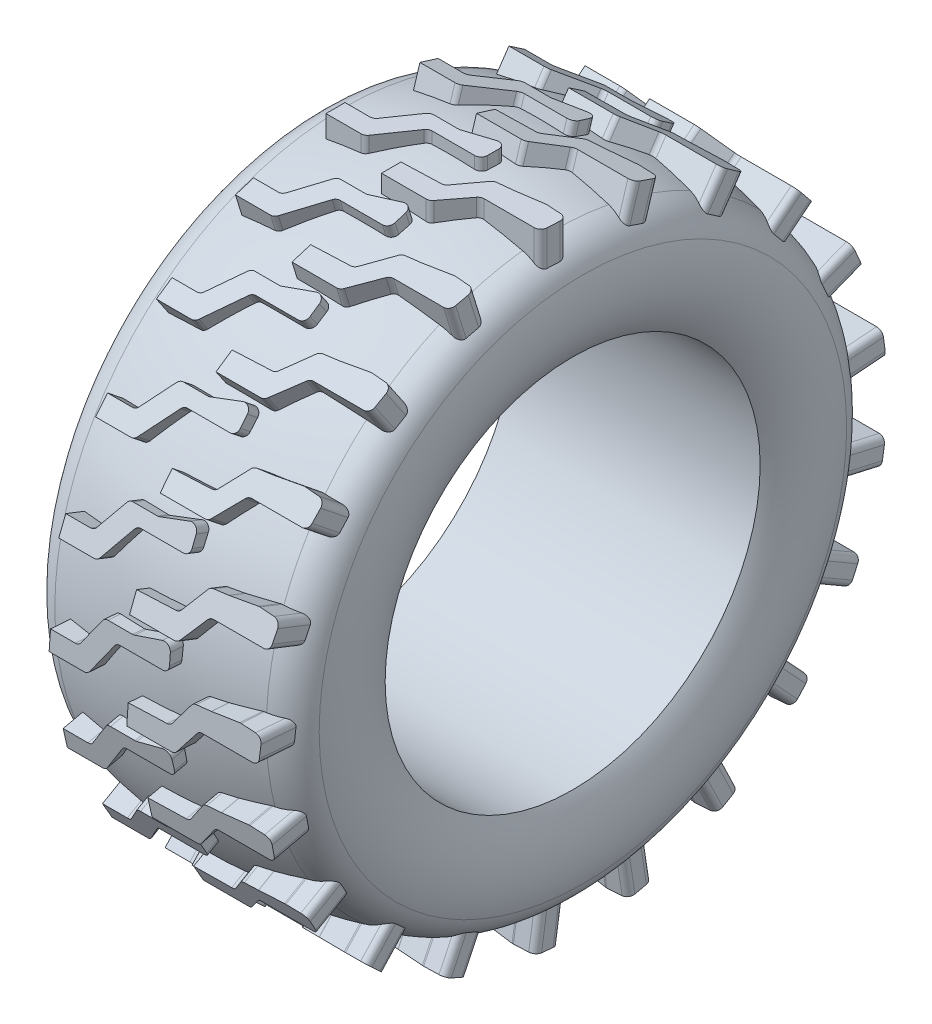
from build123d import *

# Parameters (mm, degrees)
FILLET1_R           = 60
BOSS_EXTRUDE1_DEPTH = 74
CIRPATTERN1_COUNT   = 21


with BuildPart() as part:
    # Sketch2 → Revolve1 (revolve)
    with BuildSketch(Plane.XY):
        with BuildLine():
            Line((190.247405012, 290), (-189.752594988, 290))
            ThreePointArc((-189.752594988, 290), (-213.203625034, 364.848351988), (-190.743518031, 440))
            ThreePointArc((-190.743518031, 440), (-0.248050176, 466.418915997), (190.247417679, 440))
            ThreePointArc((190.247417679, 440), (213.202375437, 364.999998061), (190.247405012, 290))
        make_face()
    revolve(axis=Axis((-383.89527027, 0, 0), (1, 0, 0)))

    # Fillet1
    fillet1_edges = [part.edges().sort_by_distance(p)[0] for p in [
        (-190.743518031, -440, 0),
        (190.247417679, -440, 0),
    ]]
    fillet(fillet1_edges, radius=FILLET1_R)

    # Sketch3 → Boss-Extrude1 (add)
    with BuildSketch(Plane(origin=(0, 410, 0), x_dir=(1, 0, 0), z_dir=(0, 1, 0))):
        with BuildLine():
            Line((48.626858711, 27.351216398), (48.626858711, 10))
            ThreePointArc((48.626858711, 10), (45.697926523, 2.928932188), (38.626858711, 0))
            Line((38.626858711, 0), (-26.948197392, 0))
            ThreePointArc((-26.948197392, 0), (-31.585344317, -1.140154155), (-35.165078775, -4.300626321))
            Line((-35.165078775, -4.300626321), (-69.999694364, -54.522268286))
            ThreePointArc((-69.999694364, -54.522268286), (-73.579428823, -57.682740452), (-78.216575748, -58.822894607))
            Line((-78.216575748, -58.822894607), (-132.401028151, -58.822894607))
            Line((-132.401028151, -58.822894607), (-132.401028151, -29.411447303))
            Line((-132.401028151, -29.411447303), (-94.061467377, -29.411447303))
            ThreePointArc((-94.061467377, -29.411447303), (-89.424320452, -28.271293148), (-85.844585994, -25.110820982))
            Line((-85.844585994, -25.110820982), (-55.565376747, 18.543216245))
            ThreePointArc((-55.565376747, 18.543216245), (-51.985642289, 21.703688411), (-47.348495364, 22.843842566))
            Line((-47.348495364, 22.843842566), (-9.546597048, 22.843842566))
            ThreePointArc((-9.546597048, 22.843842566), (-7.994583592, 22.96501398), (-6.480182069, 23.325591719))
            Line((-6.480182069, 23.325591719), (35.560443732, 36.869467244))
            ThreePointArc((35.560443732, 36.869467244), (44.514806155, 35.43404232), (48.626858711, 27.351216398))
        make_face()
        with BuildLine():
            Line((-9.546597048, -65.670623662), (-9.546597048, -95.795524072))
            Line((-9.546597048, -95.795524072), (59.482746833, -95.795524072))
            ThreePointArc((59.482746833, -95.795524072), (63.908496922, -94.762838952), (67.420165758, -91.878071302))
            Line((67.420165758, -91.878071302), (96.049207776, -54.51860802))
            ThreePointArc((96.049207776, -54.51860802), (99.560876612, -51.63384037), (103.986626701, -50.60115525))
            Line((103.986626701, -50.60115525), (181.418073474, -50.60115525))
            ThreePointArc((181.418073474, -50.60115525), (188.272839425, -47.882101875), (191.399910478, -41.203592001))
            Line((191.399910478, -41.203592001), (192.559137396, -21.996240983))
            ThreePointArc((192.559137396, -21.996240983), (190.061512139, -14.76156671), (183.179737144, -11.411967228))
            Line((183.179737144, -11.411967228), (160.818098212, -10.062368641))
            ThreePointArc((160.818098212, -10.062368641), (159.786996796, -10.053397539), (158.76045316, -10.150653765))
            Line((158.76045316, -10.150653765), (115.56992227, -16.503399453))
            ThreePointArc((115.56992227, -16.503399453), (115.361143956, -16.531864117), (115.151812244, -16.555923542))
            Line((115.151812244, -16.555923542), (92.152916225, -18.954066835))
            ThreePointArc((92.152916225, -18.954066835), (88.227660117, -20.218262881), (85.146293419, -22.95888442))
            Line((85.146293419, -22.95888442), (58.134703491, -59.529200222))
            ThreePointArc((58.134703491, -59.529200222), (54.750520151, -62.436032483), (50.438978337, -63.581884946))
            Line((50.438978337, -63.581884946), (-9.546597048, -65.670623662))
        make_face()
    boss_extrude1 = extrude(amount=BOSS_EXTRUDE1_DEPTH)

    # CirPattern1: Boss-Extrude1 ×21 about axis
    cirpattern1_axis = Axis((-383.89527027, 0, 0), (-1, 0, 0))
    for i in range(1, CIRPATTERN1_COUNT):
        add(boss_extrude1.rotate(cirpattern1_axis, i * 360 / CIRPATTERN1_COUNT))


solid = part.part
